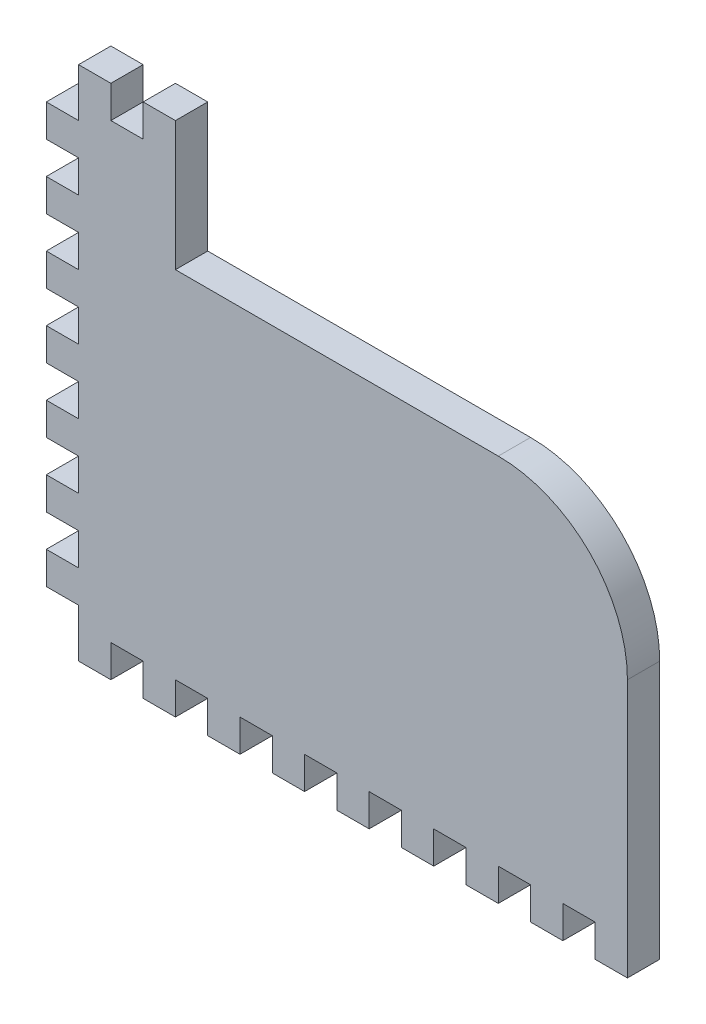
from build123d import *

# Parameters (mm, degrees)
BOSS_EXTRUDE1_DEPTH = 6.35
CAVITY2_START       = -19.049999998
CAVITY2_OUTLINE_W   = 9.525
CAVITY2_OUTLINE_H   = 6.35
CAVITY2_OUTLINE_W_2 = 6.35
CAVITY2_DEPTH       = 6.35
CAVITY2_START_2     = -6.349999998
CAVITY2_2_OUTLINE_W = 6.35
CAVITY2_2_OUTLINE_H = 6.35
CAVITY2_2_DEPTH     = 6.35
CAVITY2_START_3     = 6.350000002
CAVITY2_3_OUTLINE_W = 6.35
CAVITY2_3_OUTLINE_H = 6.35
CAVITY2_3_DEPTH     = 6.35
CAVITY2_START_4     = 19.050000002
CAVITY2_4_OUTLINE_W = 6.35
CAVITY2_4_OUTLINE_H = 6.35
CAVITY2_4_DEPTH     = 6.35
CAVITY2_START_5     = 31.750000002
CAVITY2_5_OUTLINE_W = 6.35
CAVITY2_5_OUTLINE_H = 6.35
CAVITY2_5_DEPTH     = 6.35
CAVITY2_START_6     = 44.450000002
CAVITY2_6_OUTLINE_W = 6.35
CAVITY2_6_OUTLINE_H = 6.35
CAVITY2_6_DEPTH     = 6.35
CAVITY2_START_7     = 57.150000002
CAVITY2_7_OUTLINE_W = 6.35
CAVITY2_7_OUTLINE_H = 6.35
CAVITY2_7_DEPTH     = 6.35
CAVITY2_START_8     = 69.850000002
CAVITY2_8_OUTLINE_W = 6.35
CAVITY2_8_OUTLINE_H = 6.35
CAVITY2_8_DEPTH     = 6.35
CAVITY2_START_9     = 82.550000002
CAVITY2_9_OUTLINE_W = 6.35
CAVITY2_9_OUTLINE_H = 6.35
CAVITY2_9_DEPTH     = 6.35


# Read off the part's stored shape, not the designer's step: Cavity2
with BuildPart() as part:
    # Sketch1 → Boss-Extrude1 (new body)
    with BuildSketch(Plane.XY):
        with BuildLine():
            Line((-19.049999998, -37.547541155), (6.350000002, -37.547541155))
            Line((6.350000002, -37.547541155), (6.350000002, -62.947541155))
            Line((6.350000002, -62.947541155), (69.850000002, -62.947541155))
            ThreePointArc((69.850000002, -62.947541155), (87.810512244, -70.387028913), (95.250000002, -88.347541155))
            Line((95.250000002, -88.347541155), (95.250000002, -139.147541155))
            Line((95.250000002, -139.147541155), (-19.049999998, -139.147541155))
            Line((-19.049999998, -139.147541155), (-19.049999998, -37.547541155))
        make_face()
    extrude(amount=-BOSS_EXTRUDE1_DEPTH)

    # Cavity2 outline → Cavity2 (cut)
    with BuildSketch(Plane.YZ.offset(CAVITY2_START)):
        with Locations((-134.385041155, -3.175)):
            Rectangle(CAVITY2_OUTLINE_W, CAVITY2_OUTLINE_H)
        with Locations((-120.097541155, -3.175)):
            Rectangle(CAVITY2_OUTLINE_W_2, CAVITY2_OUTLINE_H)
        with Locations((-107.397541155, -3.175)):
            Rectangle(CAVITY2_OUTLINE_W_2, CAVITY2_OUTLINE_H)
        with Locations((-94.697541155, -3.175)):
            Rectangle(CAVITY2_OUTLINE_W_2, CAVITY2_OUTLINE_H)
        with Locations((-81.997541155, -3.175)):
            Rectangle(CAVITY2_OUTLINE_W_2, CAVITY2_OUTLINE_H)
        with Locations((-69.297541155, -3.175)):
            Rectangle(CAVITY2_OUTLINE_W_2, CAVITY2_OUTLINE_H)
        with Locations((-56.597541155, -3.175)):
            Rectangle(CAVITY2_OUTLINE_W_2, CAVITY2_OUTLINE_H)
        with Locations((-42.310041155, -3.175)):
            Rectangle(CAVITY2_OUTLINE_W, CAVITY2_OUTLINE_H)
    extrude(amount=CAVITY2_DEPTH, mode=Mode.SUBTRACT)

    # Cavity2 2 outline → Cavity2 2 (cut)
    with BuildSketch(Plane.YZ.offset(CAVITY2_START_2)):
        with Locations((-135.972541155, -3.175)):
            Rectangle(CAVITY2_2_OUTLINE_W, CAVITY2_2_OUTLINE_H)
        with Locations((-40.722541155, -3.175)):
            Rectangle(CAVITY2_2_OUTLINE_W, CAVITY2_2_OUTLINE_H)
    extrude(amount=CAVITY2_2_DEPTH, mode=Mode.SUBTRACT)

    # Cavity2 3 outline → Cavity2 3 (cut)
    with BuildSketch(Plane.YZ.offset(CAVITY2_START_3)):
        with Locations((-135.972541155, -3.175)):
            Rectangle(CAVITY2_3_OUTLINE_W, CAVITY2_3_OUTLINE_H)
    extrude(amount=CAVITY2_3_DEPTH, mode=Mode.SUBTRACT)

    # Cavity2 4 outline → Cavity2 4 (cut)
    with BuildSketch(Plane.YZ.offset(CAVITY2_START_4)):
        with Locations((-135.972541155, -3.175)):
            Rectangle(CAVITY2_4_OUTLINE_W, CAVITY2_4_OUTLINE_H)
    extrude(amount=CAVITY2_4_DEPTH, mode=Mode.SUBTRACT)

    # Cavity2 5 outline → Cavity2 5 (cut)
    with BuildSketch(Plane.YZ.offset(CAVITY2_START_5)):
        with Locations((-135.972541155, -3.175)):
            Rectangle(CAVITY2_5_OUTLINE_W, CAVITY2_5_OUTLINE_H)
    extrude(amount=CAVITY2_5_DEPTH, mode=Mode.SUBTRACT)

    # Cavity2 6 outline → Cavity2 6 (cut)
    with BuildSketch(Plane.YZ.offset(CAVITY2_START_6)):
        with Locations((-135.972541155, -3.175)):
            Rectangle(CAVITY2_6_OUTLINE_W, CAVITY2_6_OUTLINE_H)
    extrude(amount=CAVITY2_6_DEPTH, mode=Mode.SUBTRACT)

    # Cavity2 7 outline → Cavity2 7 (cut)
    with BuildSketch(Plane.YZ.offset(CAVITY2_START_7)):
        with Locations((-135.972541155, -3.175)):
            Rectangle(CAVITY2_7_OUTLINE_W, CAVITY2_7_OUTLINE_H)
    extrude(amount=CAVITY2_7_DEPTH, mode=Mode.SUBTRACT)

    # Cavity2 8 outline → Cavity2 8 (cut)
    with BuildSketch(Plane.YZ.offset(CAVITY2_START_8)):
        with Locations((-135.972541155, -3.175)):
            Rectangle(CAVITY2_8_OUTLINE_W, CAVITY2_8_OUTLINE_H)
    extrude(amount=CAVITY2_8_DEPTH, mode=Mode.SUBTRACT)

    # Cavity2 9 outline → Cavity2 9 (cut)
    with BuildSketch(Plane.YZ.offset(CAVITY2_START_9)):
        with Locations((-135.972541155, -3.175)):
            Rectangle(CAVITY2_9_OUTLINE_W, CAVITY2_9_OUTLINE_H)
    extrude(amount=CAVITY2_9_DEPTH, mode=Mode.SUBTRACT)


solid = part.part
